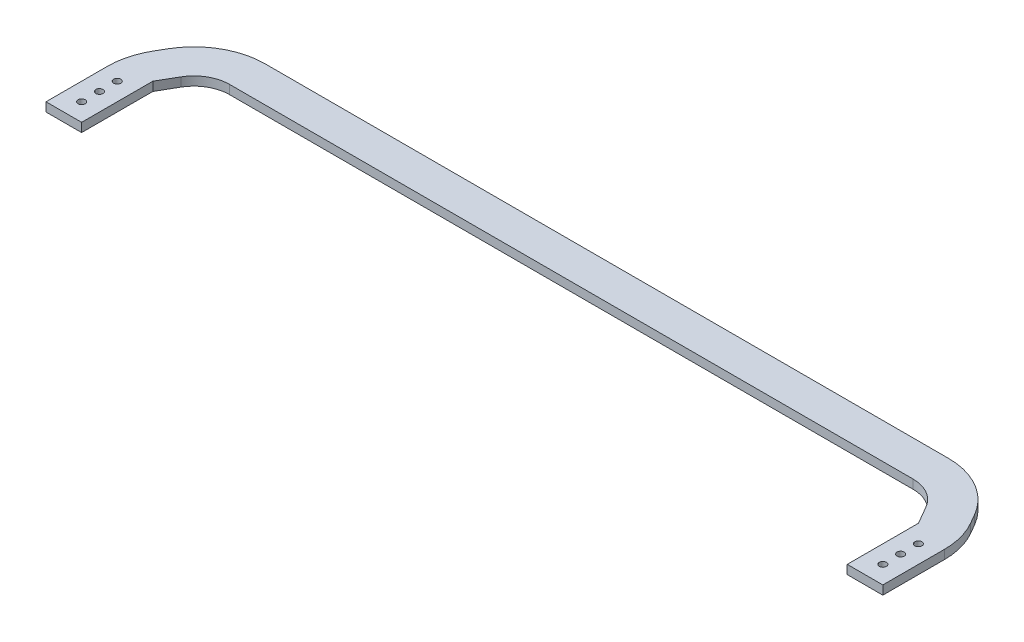
from build123d import *

# Parameters (mm, degrees)
BOSS_EXTRUDE1_DEPTH    = 6.35
F_10_CLEARANCE_HOLE1_D = 5.1054


with BuildPart() as part:
    # Sketch1 → Boss-Extrude1 (new body)
    with BuildSketch(Plane(origin=(0, 0, 0), x_dir=(1, 0, 0), z_dir=(0, 1, 0))):
        with BuildLine():
            Line((-273.05, -50.8), (-273.05, 0))
            Line((-273.05, 0), (-265.717651581, 12.7))
            ThreePointArc((-265.717651581, 12.7), (-256.420606325, 21.997045256), (-243.720606325, 25.4))
            Line((-243.720606325, 25.4), (243.720606325, 25.4))
            ThreePointArc((243.720606325, 25.4), (256.420606325, 21.997045256), (265.717651581, 12.7))
            Line((265.717651581, 12.7), (273.05, 0))
            Line((273.05, 0), (273.05, -50.8))
            Line((273.05, -50.8), (298.45, -50.8))
            Line((298.45, -50.8), (298.45, -6.805909488))
            ThreePointArc((298.45, -6.805909488), (296.719031975, 6.342098003), (291.644090512, 18.594090512))
            Line((291.644090512, 18.594090512), (287.714696837, 25.4))
            ThreePointArc((287.714696837, 25.4), (269.120606325, 43.994090512), (243.720606325, 50.8))
            Line((243.720606325, 50.8), (-243.720606325, 50.8))
            ThreePointArc((-243.720606325, 50.8), (-269.120606325, 43.994090512), (-287.714696837, 25.4))
            Line((-287.714696837, 25.4), (-291.644090512, 18.594090512))
            ThreePointArc((-291.644090512, 18.594090512), (-296.719031975, 6.342098003), (-298.45, -6.805909488))
            Line((-298.45, -6.805909488), (-298.45, -50.8))
            Line((-298.45, -50.8), (-273.05, -50.8))
        make_face()
    extrude(amount=BOSS_EXTRUDE1_DEPTH)

    # #10 Clearance Hole1 (through all)
    with Locations(Plane(origin=(0, 6.35, 0), x_dir=(1, 0, 0), z_dir=(0, 1, 0))):
        with Locations((-285.75, -38.1), (-285.75, -25.4), (-285.75, -12.7), (285.75, -12.7), (285.75, -25.4), (285.75, -38.1)):
            Hole(F_10_CLEARANCE_HOLE1_D / 2)


solid = part.part
